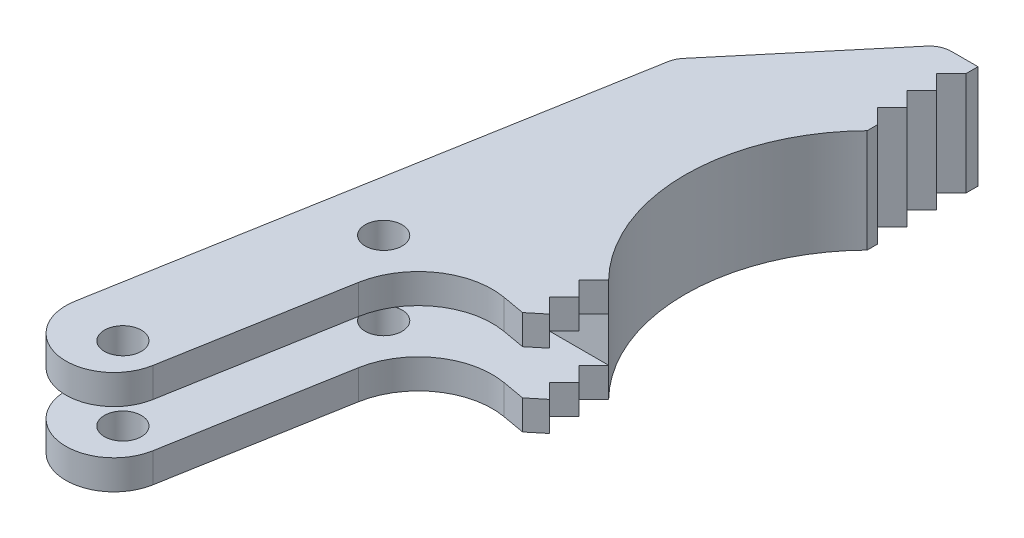
from build123d import *

# Parameters (mm, degrees)
SKETCH1_R              = 2.5
BOSS_EXTRUDE1_DEPTH    = 7
CUT_EXTRUDE1_START     = -40
CUT_EXTRUDE1_OUTLINE_W = 34.803170534
CUT_EXTRUDE1_OUTLINE_H = 6
CUT_EXTRUDE1_DEPTH     = 46.239041119
FILLET1_R              = 3


# Read off the part's stored shape, not the designer's step: Cut-Extrude1
with BuildPart() as part:
    # Sketch1 → Boss-Extrude1 (new, symmetric)
    with BuildSketch(Plane(origin=(0, 0, 0), x_dir=(1, 0, 0), z_dir=(0, 1, 0))):
        with BuildLine():
            Line((-16.647024265, 22.786117759), (-20.826247522, -0.869862938))
            ThreePointArc((-20.826247522, -0.869862938), (-28.357947563, -6.139919341), (-33.628003966, 1.391780701))
            Line((-33.628003966, 1.391780701), (-21.433938056, 70.414795281))
            Line((-21.433938056, 70.414795281), (-5, 90))
            Line((-5, 90), (0, 90))
            Line((0, 90), (0, 88.40012962))
            Line((0, 88.40012962), (-2, 86.400129391))
            Line((-2, 86.400129391), (0, 84.40012962))
            Line((0, 84.40012962), (-2, 82.400129391))
            Line((-2, 82.400129391), (0, 80.40012962))
            Line((0, 80.40012962), (-2, 78.400129391))
            Line((-2, 78.400129391), (0, 76.40012962))
            Line((0, 76.40012962), (0, 75))
            ThreePointArc((0, 75), (-7.146428929, 57.5), (0, 40))
            Line((0, 40), (-2, 38.00000006))
            Line((-2, 38.00000006), (0, 36))
            Line((0, 36), (-2, 34.00000006))
            Line((-2, 34.00000006), (0, 32))
            Line((0, 32), (-2, 30.353333333))
            Line((-2, 30.353333333), (-5.059793432, 30.89389684))
            ThreePointArc((-5.059793432, 30.89389684), (-12.532584877, 29.23980138), (-16.647024265, 22.786117759))
        make_face()
        with Locations(Location((-25.75, 0, 0), (0, 0, 270))):
            Circle(SKETCH1_R, mode=Mode.SUBTRACT)
        with Locations(Location((-20.45, 30, 0), (0, 0, 270))):
            Circle(SKETCH1_R, mode=Mode.SUBTRACT)
    extrude(amount=BOSS_EXTRUDE1_DEPTH, both=True)

    # Cut-Extrude1 outline → Cut-Extrude1 (cut)
    with BuildSketch(Plane.XY.offset(CUT_EXTRUDE1_START)):
        with Locations((-17.401585267, 0)):
            Rectangle(CUT_EXTRUDE1_OUTLINE_W, CUT_EXTRUDE1_OUTLINE_H)
    extrude(amount=CUT_EXTRUDE1_DEPTH, mode=Mode.SUBTRACT)

    # Fillet1
    fillet1_edges = [part.edges().sort_by_distance(p)[0] for p in [
        (-21.433938056, 0, -70.414795281),
        (-5, 0, -90),
    ]]
    fillet(fillet1_edges, radius=FILLET1_R)


solid = part.part
